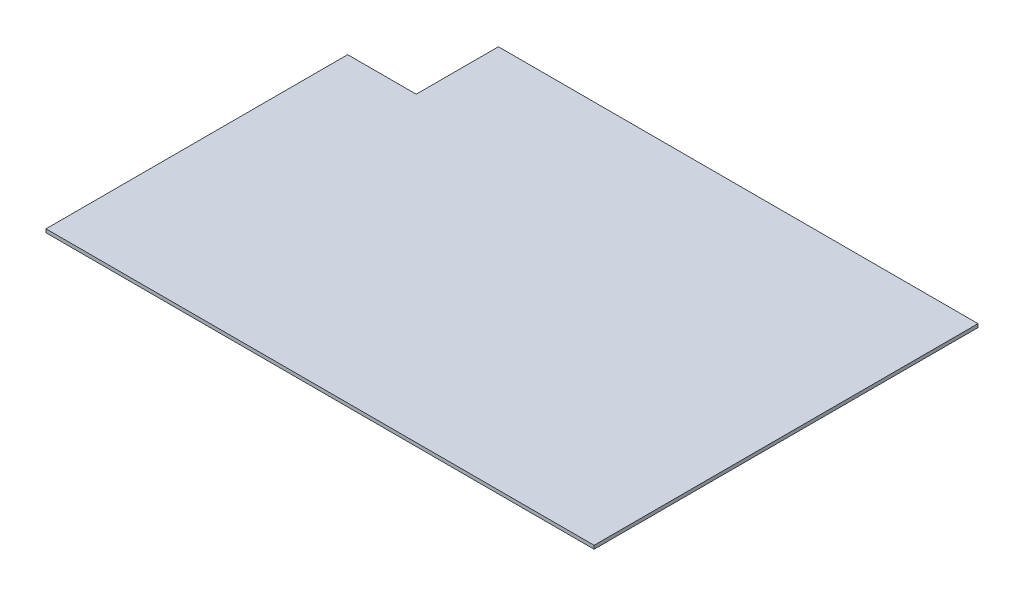
from build123d import *

# Parameters (mm, degrees)
BOSS_EXTRUDE1_DEPTH = 1.6002


with BuildPart() as part:
    # Sketch1 → Boss-Extrude1 (new body)
    with BuildSketch(Plane(origin=(0, 0, 0), x_dir=(1, 0, 0), z_dir=(0, 1, 0))):
        Polygon((-124.27279724, 140.311267915), (-124.27279724, 0.515267915), (129.72720276, 0.515267915), (129.72720276, 178.411267915), (-92.52279724, 178.411267915), (-92.52279724, 140.311267915), align=None)
    extrude(amount=BOSS_EXTRUDE1_DEPTH)


solid = part.part
